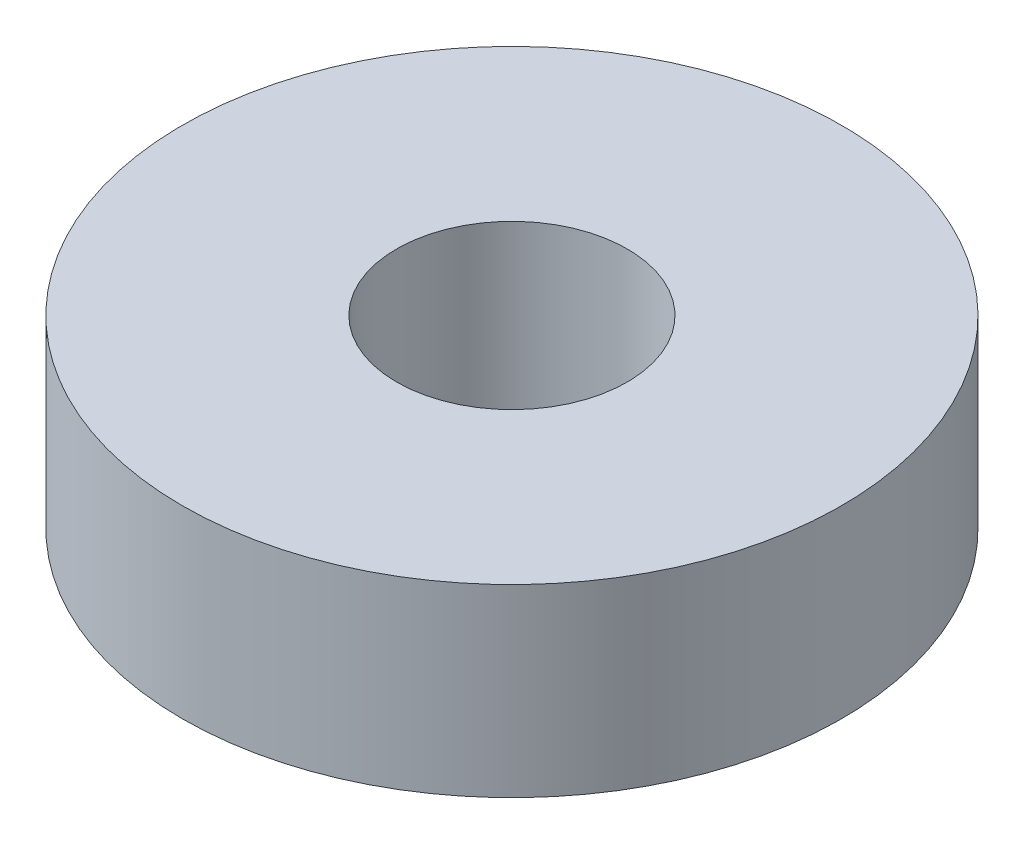
from build123d import *

# Parameters (mm, degrees)
SKETCH1_R           = 50
BOSS_EXTRUDE1_DEPTH = 28
SKETCH2_R           = 17.5
CUT_EXTRUDE1_DEPTH  = 77.052613367


with BuildPart() as part:
    # Sketch1 → Boss-Extrude1 (new body)
    with BuildSketch(Plane(origin=(0, 0, 0), x_dir=(1, 0, 0), z_dir=(0, 1, 0))):
        Circle(SKETCH1_R)
    extrude(amount=BOSS_EXTRUDE1_DEPTH)

    # Sketch2 → Cut-Extrude1 (cut, through all)
    with BuildSketch(Plane(origin=(0, 0, 0), x_dir=(1, 0, 0), z_dir=(0, 1, 0))):
        Circle(SKETCH2_R)
    extrude(amount=CUT_EXTRUDE1_DEPTH, mode=Mode.SUBTRACT)


solid = part.part
